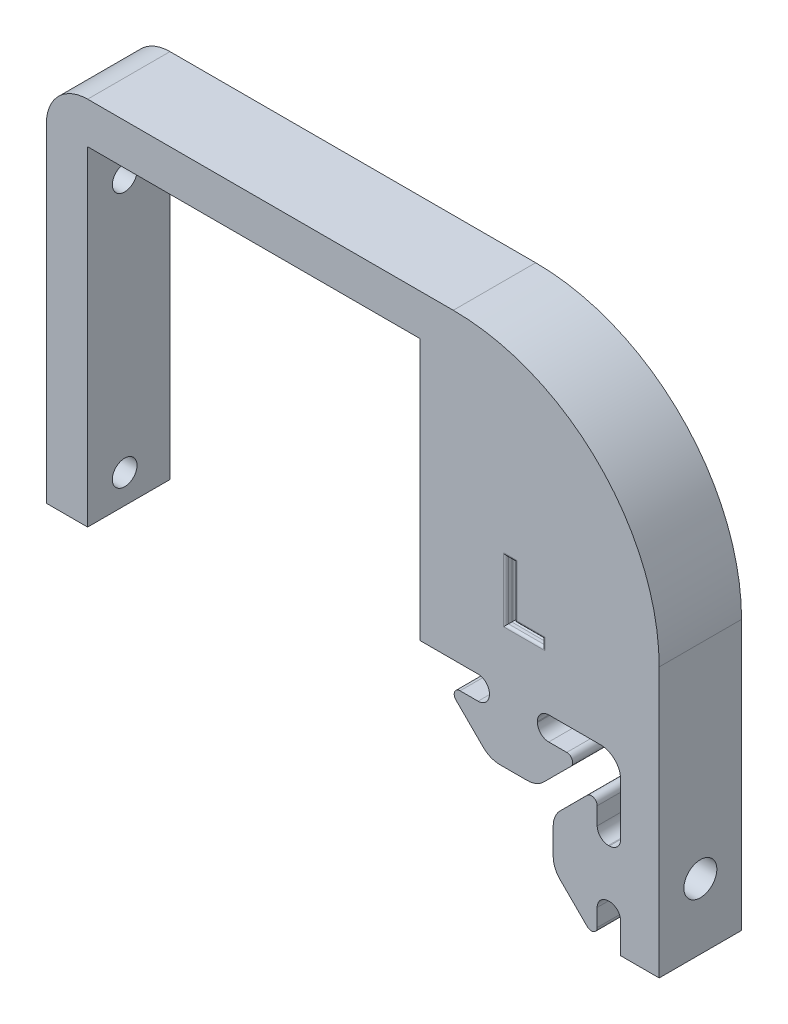
from build123d import *

# Parameters (mm, degrees)
BOSS_EXTRUDE1_DEPTH = 10
CUT_EXTRUDE1_REACH  = 92.069
SKETCH2_R           = 1.5
FILLET3_R           = 5
CUT_EXTRUDE2_REACH  = 92.069
SKETCH3_R           = 2
FILLET4_R           = 25
CUT_EXTRUDE7_DEPTH  = 1
FILLET8_R           = 0.3
SKETCH8_W           = 10
SKETCH8_H           = 31.75
BOSS_EXTRUDE2_DEPTH = 0.8


with BuildPart() as part:
    # Sketch1 → Boss-Extrude1 (new body)
    with BuildSketch(Plane.XY):
        with BuildLine():
            Line((13.02, -7.9417418), (17.7, -7.9417418))
            Line((17.7, -7.9417418), (17.7, 49.77))
            Line((17.7, 49.77), (-56.7, 49.77))
            Line((-56.7, 49.77), (-56.7, 4.77))
            Line((-56.7, 4.77), (-51.7, 4.77))
            Line((-51.7, 4.77), (-51.7, 44.77))
            Line((-51.7, 44.77), (-10.566443095, 44.77))
            Line((-10.566443095, 44.77), (-10.566443095, 13.02))
            Line((-10.566443095, 13.02), (-5.317126718, 13.02))
            Line((-5.317126718, 13.02), (-4.287512407, 13.02))
            ThreePointArc((-4.287512407, 13.02), (-3.319474451, 12.619025549), (-2.9185, 11.650987593))
            Line((-2.9185, 11.650987593), (-2.9185, 11.539212407))
            ThreePointArc((-2.9185, 11.539212407), (-3.319474451, 10.571174451), (-4.287512407, 10.1702))
            Line((-4.287512407, 10.1702), (-6.476788598, 10.1702))
            ThreePointArc((-6.476788598, 10.1702), (-7.136510935, 9.729114651), (-6.981020848, 8.950903446))
            Line((-6.981020848, 8.950903446), (-3.672257405, 5.649701928))
            ThreePointArc((-3.672257405, 5.649701928), (-2.746830644, 5.032499411), (-1.655778399, 4.8158))
            Line((-1.655778399, 4.8158), (1.655778399, 4.8158))
            ThreePointArc((1.655778399, 4.8158), (2.746830644, 5.032499411), (3.672257405, 5.649701928))
            Line((3.672257405, 5.649701928), (6.981020848, 8.950903446))
            ThreePointArc((6.981020848, 8.950903446), (7.136510935, 9.729114651), (6.476788598, 10.1702))
            Line((6.476788598, 10.1702), (4.287512407, 10.1702))
            ThreePointArc((4.287512407, 10.1702), (3.319474451, 10.571174451), (2.9185, 11.539212407))
            Line((2.9185, 11.539212407), (2.9185, 11.650987593))
            ThreePointArc((2.9185, 11.650987593), (3.319474451, 12.619025549), (4.287512407, 13.02))
            Line((4.287512407, 13.02), (6.332886163, 13.02))
            Line((6.332886163, 13.02), (10.562594215, 13.019824354))
            ThreePointArc((10.562594215, 13.019824354), (12.303594776, 12.313982883), (13.019956614, 10.577284622))
            Line((13.019956614, 10.577284622), (13.02, 4.287469289))
            ThreePointArc((13.02, 4.287469289), (12.619025549, 3.319431332), (11.650987593, 2.918456882))
            Line((11.650987593, 2.918456882), (11.539212407, 2.918456882))
            ThreePointArc((11.539212407, 2.918456882), (10.571174451, 3.319431332), (10.1702, 4.287469289))
            Line((10.1702, 4.287469289), (10.1702, 6.402089023))
            ThreePointArc((10.1702, 6.402089023), (9.733877283, 7.055496588), (8.963146507, 6.90287605))
            Line((8.963146507, 6.90287605), (5.667020993, 3.614283579))
            ThreePointArc((5.667020993, 3.614283579), (5.046449321, 2.687255303), (4.8285, 1.593185507))
            Line((4.8285, 1.593185507), (4.8285, -1.593185507))
            ThreePointArc((4.8285, -1.593185507), (5.046449321, -2.687255303), (5.667020993, -3.614283579))
            Line((5.667020993, -3.614283579), (8.963146507, -6.90287605))
            ThreePointArc((8.963146507, -6.90287605), (9.733877283, -7.055496588), (10.1702, -6.402089023))
            Line((10.1702, -6.402089023), (10.1702, -4.287469289))
            ThreePointArc((10.1702, -4.287469289), (10.571174451, -3.319431332), (11.539212407, -2.918456882))
            Line((11.539212407, -2.918456882), (11.650987593, -2.918456882))
            ThreePointArc((11.650987593, -2.918456882), (12.619025549, -3.319431332), (13.02, -4.287469289))
            Line((13.02, -4.287469289), (13.02, -5.3170836))
            Line((13.02, -5.3170836), (13.02, -7.9417418))
        make_face()
    extrude(amount=BOSS_EXTRUDE1_DEPTH)

    # Sketch2 → Cut-Extrude1 (cut, up to next)
    with BuildSketch(Plane.ZY.offset(56.7), mode=Mode.PRIVATE) as cut_extrude1_sk1:
        with Locations((5.5, 8.27)):
            Circle(SKETCH2_R)
    cut_extrude1_tool1 = extrude(cut_extrude1_sk1.sketch, amount=-CUT_EXTRUDE1_REACH, mode=Mode.PRIVATE) & part.part
    # Sketch2 → Cut-Extrude1 (cut, up to next)
    with BuildSketch(Plane.ZY.offset(56.7), mode=Mode.PRIVATE) as cut_extrude1_sk2:
        with Locations((5.5, 39.27)):
            Circle(SKETCH2_R)
    cut_extrude1_tool2 = extrude(cut_extrude1_sk2.sketch, amount=-CUT_EXTRUDE1_REACH, mode=Mode.PRIVATE) & part.part
    add(cut_extrude1_tool1.solids().sort_by_distance((-56.7, 8.27, 5.5))[0], mode=Mode.SUBTRACT)
    add(cut_extrude1_tool2.solids().sort_by_distance((-56.7, 39.27, 5.5))[0], mode=Mode.SUBTRACT)

    # Fillet3
    fillet3_edges = [part.edges().sort_by_distance(p)[0] for p in [
        (-56.7, 49.77, 5),
    ]]
    fillet(fillet3_edges, radius=FILLET3_R)

    # Sketch3 → Cut-Extrude2 (cut, up to next)
    with BuildSketch(Plane(origin=(17.7, 0, 0), x_dir=(0, 0, -1), z_dir=(1, 0, 0)), mode=Mode.PRIVATE) as cut_extrude2_sk1:
        with Locations((-5, 0)):
            Circle(SKETCH3_R)
    cut_extrude2_tool1 = extrude(cut_extrude2_sk1.sketch, amount=-CUT_EXTRUDE2_REACH, mode=Mode.PRIVATE) & part.part
    add(cut_extrude2_tool1.solids().sort_by_distance((17.7, 0, 5))[0], mode=Mode.SUBTRACT)

    # Fillet4
    fillet4_edges = [part.edges().sort_by_distance(p)[0] for p in [
        (17.7, 49.77, 5),
    ]]
    fillet(fillet4_edges, radius=FILLET4_R)

    # Sketch7 → Cut-Extrude7 (cut)
    with BuildSketch(Plane.XY.offset(10)):
        Polygon((-0.90100078, 19.84300121), (-0.90100078, 27.034293528), (0.113155829, 27.034293528), (0.113155829, 20.672765708), (3.524409877, 20.672765708), (3.524409877, 19.84300121), align=None)
    extrude(amount=-CUT_EXTRUDE7_DEPTH, mode=Mode.SUBTRACT)

    # Fillet8
    fillet8_edges = [part.edges().sort_by_distance(p)[0] for p in [
        (-0.90100078, 23.438647369, 9),
        (-0.393922475, 27.034293528, 9),
        (0.113155829, 23.853529618, 9),
        (1.818782853, 20.672765708, 9),
        (3.524409877, 20.257883459, 9),
        (1.311704549, 19.84300121, 9),
        (1.311704549, 19.84300121, 10),
        (3.524409877, 20.257883459, 10),
        (1.818782853, 20.672765708, 10),
        (0.113155829, 23.853529618, 10),
        (-0.393922475, 27.034293528, 10),
        (-0.90100078, 23.438647369, 10),
    ]]
    fillet(fillet8_edges, radius=FILLET8_R)

    # Sketch8 → Boss-Extrude2 (add)
    with BuildSketch(Plane.ZY.offset(10.566443095)):
        with Locations((5, 28.895)):
            Rectangle(SKETCH8_W, SKETCH8_H)
    extrude(amount=BOSS_EXTRUDE2_DEPTH)


solid = part.part
